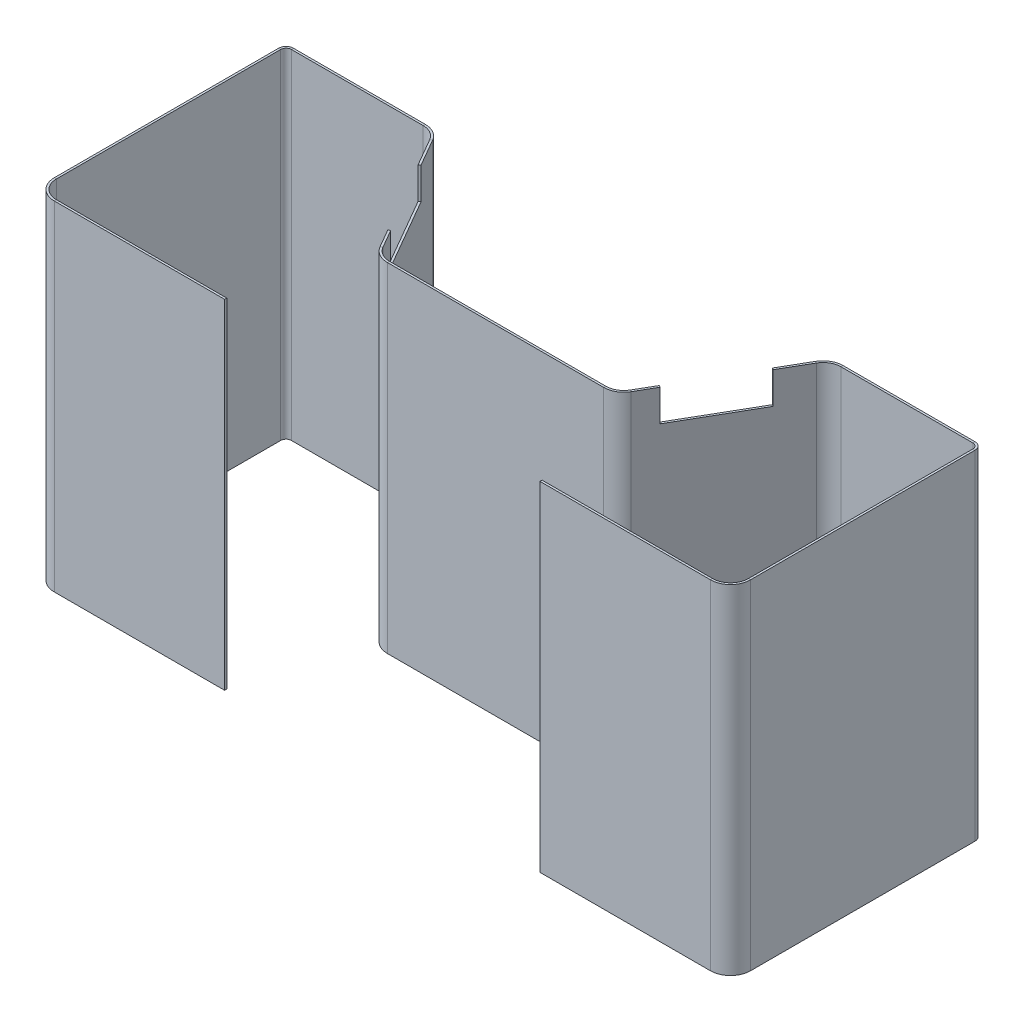
from build123d import *

# Parameters (mm, degrees)
T_LE_DE_BASE_PLI_E1_DEPTH = 160
ENL_V_MAT_EXTRU_1_REACH   = 277.896
ESQUISSE2_W               = 39.08587988
ESQUISSE2_H               = 15


# Read off the part's stored shape, not the designer's step: Tôle de base pliée1
with BuildPart() as part:
    # Tôle de base pliée1 outline → Tôle de base pliée1 (new body)
    with BuildSketch(Plane(origin=(0, 0, 0), x_dir=(1, 0, 0), z_dir=(0, 1, 0))):
        with BuildLine():
            Line((155, -53.5), (74.5, -53.5))
            Line((74.5, -53.5), (74.5, -54.5))
            Line((74.5, -54.5), (155, -54.5))
            ThreePointArc((155, -54.5), (161.717514421, -51.717514421), (164.5, -45))
            Line((164.5, -45), (164.5, 61))
            ThreePointArc((164.5, 61), (163.474873734, 63.474873734), (161, 64.5))
            Line((161, 64.5), (98.72391992, 64.5))
            ThreePointArc((98.72391992, 64.5), (93.97391992, 63.227241336), (90.496678584, 59.75))
            Line((90.496678584, 59.75), (58.453738644, 4.25))
            ThreePointArc((58.453738644, 4.25), (55.342522712, 1.138784068), (51.092522712, 0))
            Line((51.092522712, 0), (-51.092522712, 0))
            ThreePointArc((-51.092522712, 0), (-55.342522712, 1.138784068), (-58.453738644, 4.25))
            Line((-58.453738644, 4.25), (-90.496678584, 59.75))
            ThreePointArc((-90.496678584, 59.75), (-93.97391992, 63.227241336), (-98.72391992, 64.5))
            Line((-98.72391992, 64.5), (-161, 64.5))
            ThreePointArc((-161, 64.5), (-163.474873734, 63.474873734), (-164.5, 61))
            Line((-164.5, 61), (-164.5, -45))
            ThreePointArc((-164.5, -45), (-161.717514421, -51.717514421), (-155, -54.5))
            Line((-155, -54.5), (-74.5, -54.5))
            Line((-74.5, -54.5), (-74.5, -53.5))
            Line((-74.5, -53.5), (-155, -53.5))
            ThreePointArc((-155, -53.5), (-161.01040764, -51.01040764), (-163.5, -45))
            Line((-163.5, -45), (-163.5, 61))
            ThreePointArc((-163.5, 61), (-162.767766953, 62.767766953), (-161, 63.5))
            Line((-161, 63.5), (-98.72391992, 63.5))
            ThreePointArc((-98.72391992, 63.5), (-94.47391992, 62.361215932), (-91.362703988, 59.25))
            Line((-91.362703988, 59.25), (-59.319764048, 3.75))
            ThreePointArc((-59.319764048, 3.75), (-55.842522712, 0.272758664), (-51.092522712, -1))
            Line((-51.092522712, -1), (51.092522712, -1))
            ThreePointArc((51.092522712, -1), (55.842522712, 0.272758664), (59.319764048, 3.75))
            Line((59.319764048, 3.75), (91.362703988, 59.25))
            ThreePointArc((91.362703988, 59.25), (94.47391992, 62.361215932), (98.72391992, 63.5))
            Line((98.72391992, 63.5), (161, 63.5))
            ThreePointArc((161, 63.5), (162.767766953, 62.767766953), (163.5, 61))
            Line((163.5, 61), (163.5, -45))
            ThreePointArc((163.5, -45), (161.01040764, -51.01040764), (155, -53.5))
        make_face()
    extrude(amount=T_LE_DE_BASE_PLI_E1_DEPTH)

    # Esquisse2 → Enlèv. mat.-Extru.1 (cut, up to next)
    with BuildSketch(Plane(origin=(42, 0, 24.248711306), x_dir=(-0.4999999999999975, 0, 0.86602540378444), z_dir=(-0.86602540378444, 0, -0.4999999999999975)), mode=Mode.PRIVATE) as enl_v_mat_extru_1_sk1:
        with Locations((-62.450417228, 152.5)):
            Rectangle(ESQUISSE2_W, ESQUISSE2_H)
    enl_v_mat_extru_1_tool1 = extrude(enl_v_mat_extru_1_sk1.sketch, amount=-ENL_V_MAT_EXTRU_1_REACH, mode=Mode.PRIVATE) & part.part
    enl_v_mat_extru_1 = enl_v_mat_extru_1_tool1.solids().sort_by_distance((73.225209, 152.5, -29.834936))[0]
    add(enl_v_mat_extru_1, mode=Mode.SUBTRACT)

    # Symétrie1: Enlèv. mat.-Extru.1 across plane
    add(enl_v_mat_extru_1.mirror(Plane(origin=(0, 0, 0), x_dir=(0, 0, 1), z_dir=(1, 0, 0))), mode=Mode.SUBTRACT)


solid = part.part
